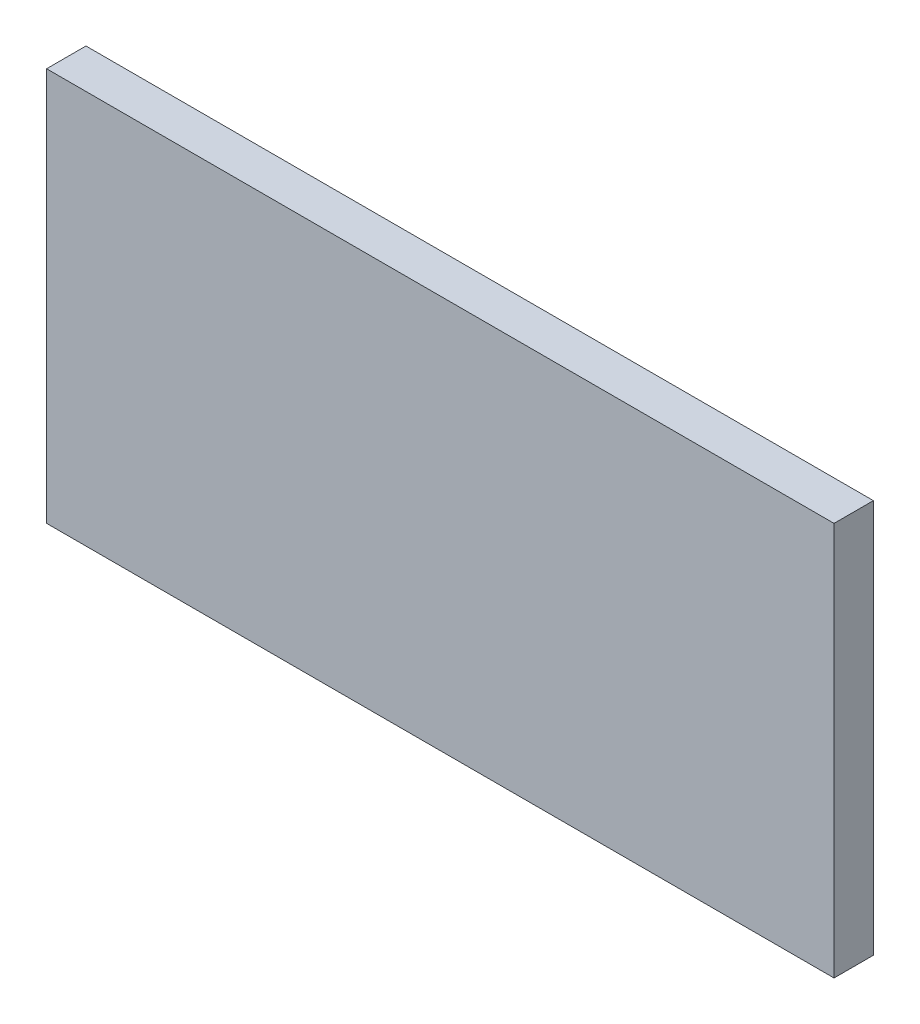
from build123d import *

# Parameters (mm, degrees)
SKETCH1_W           = 200
SKETCH1_H           = 100
BOSS_EXTRUDE1_DEPTH = 10


with BuildPart() as part:
    # Sketch1 → Boss-Extrude1 (new body)
    with BuildSketch(Plane.XY):
        with Locations((-100, -50)):
            Rectangle(SKETCH1_W, SKETCH1_H)
    extrude(amount=BOSS_EXTRUDE1_DEPTH)


solid = part.part
